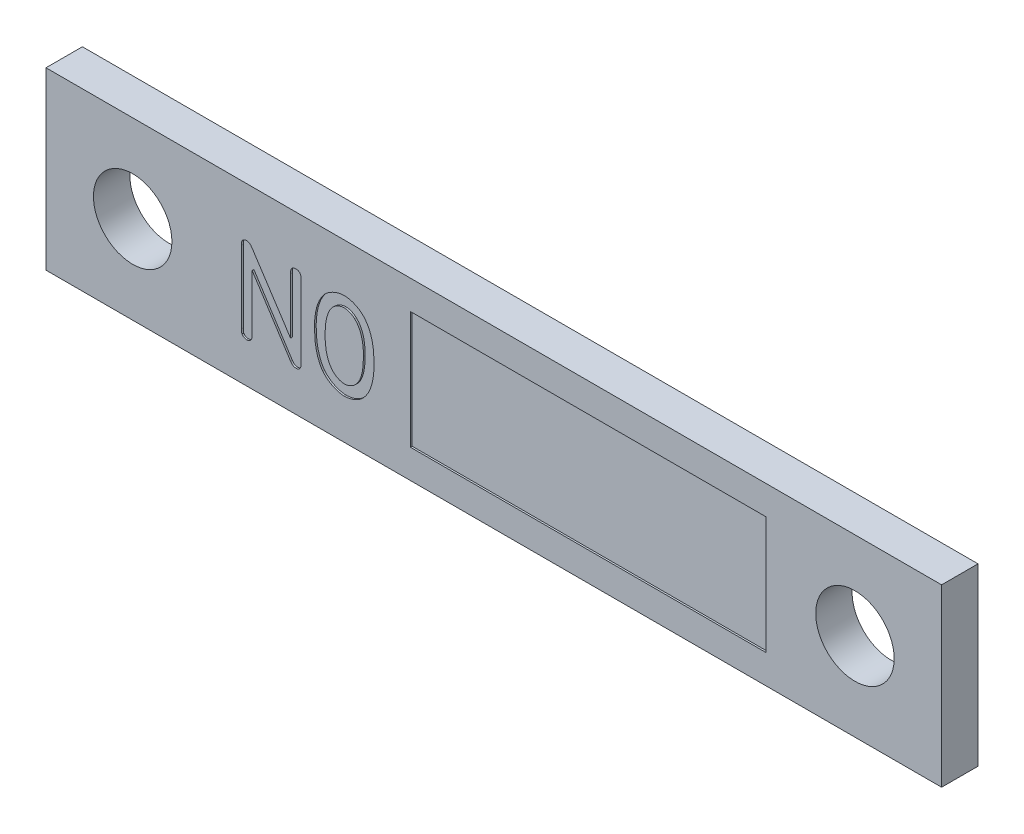
from build123d import *

# Parameters (mm, degrees)
SKETCH1_W               = 39.37
SKETCH1_H               = 7.706149234
BOSS_EXTRUDE1_DEPTH     = 1.6
CUT_EXTRUDE2_DEPTH      = 41.148992964
CUT_EXTRUDE2_DEPTH_BACK = 41.148992964
SKETCH2_R               = 1.725
WRAP1_START             = -0.0762
WRAP1_DEPTH             = 0.0762
SKETCH4_W               = 15.621930361
SKETCH4_H               = 5.167659232
CUT_EXTRUDE3_DEPTH      = 0.0762


# Read off the part's stored shape, not the designer's step: Wrap1
with BuildPart() as part:
    # Sketch1 → Boss-Extrude1 (new body)
    with BuildSketch(Plane.XY):
        with Locations((19.685, 3.853074617)):
            Rectangle(SKETCH1_W, SKETCH1_H)
    extrude(amount=BOSS_EXTRUDE1_DEPTH)

    # Sketch2 → Cut-Extrude2 (cut, two sides: drawn at the far end of the back side and taken through both)
    with BuildSketch(Plane.XY.offset(-CUT_EXTRUDE2_DEPTH_BACK)):
        with Locations((3.81, 3.853074617)):
            Circle(SKETCH2_R)
        with Locations((35.56, 3.853074617)):
            Circle(SKETCH2_R)
    extrude(amount=CUT_EXTRUDE2_DEPTH + CUT_EXTRUDE2_DEPTH_BACK, mode=Mode.SUBTRACT)

    # Wrap1 outline → Wrap1 (cut)
    # profile 1 of 2: a face of its own
    with BuildSketch(Plane.XY.offset(1.6).offset(WRAP1_START)):
        with BuildLine():
            add(Edge.make_bspline(
                [(13.114745089, 5.591356077), (13.076489227, 5.589397122), (12.999650925, 5.585462489), (12.884094832, 5.565152142), (12.768623166, 5.531800478), (12.653214187, 5.487937137), (12.542067693, 5.432545206), (12.436921753, 5.367896238), (12.338733279, 5.295413374), (12.279859734, 5.239732492), (12.250557489, 5.212019284)],
                knots=[0, 0, 0, 0, 0.118899942, 0.238814893, 0.363411662, 0.491768315, 0.621792008, 0.748493912, 0.874821655, 1, 1, 1, 1], degree=3))
            add(Edge.make_bspline(
                [(12.250557489, 5.212019284), (12.214672523, 5.169057329), (12.141638371, 5.081619877), (12.051342353, 4.932144564), (11.973476954, 4.767457905), (11.910976904, 4.586374315), (11.862253256, 4.390351187), (11.826140479, 4.180749027), (11.804813001, 3.957581581), (11.802033849, 3.804466259), (11.800607268, 3.725869831)],
                knots=[0, 0, 0, 0, 0.105704853, 0.215133666, 0.329018149, 0.449630503, 0.576639017, 0.710540967, 0.851416267, 1, 1, 1, 1], degree=3))
            add(Edge.make_bspline(
                [(11.800607268, 3.725869831), (11.801644514, 3.646192804), (11.803657438, 3.491568084), (11.821016364, 3.267294981), (11.849424873, 3.0577363), (11.889201594, 2.863083831), (11.94048741, 2.683253436), (12.004237397, 2.518833714), (12.07758583, 2.368094483), (12.138653078, 2.277954892), (12.168449785, 2.233972839)],
                knots=[0, 0, 0, 0, 0.153123595, 0.29715834, 0.432036511, 0.559346103, 0.678716767, 0.790963146, 0.898004084, 1, 1, 1, 1], degree=3))
            add(Edge.make_bspline(
                [(12.168449785, 2.233972839), (12.197481969, 2.20034568), (12.255962581, 2.132609239), (12.359424799, 2.04435806), (12.473344172, 1.964078991), (12.597649228, 1.894401209), (12.727944742, 1.837295079), (12.860759165, 1.796199072), (12.993043465, 1.768321671), (13.081902523, 1.763993136), (13.12582562, 1.761853538)],
                knots=[0, 0, 0, 0, 0.121113158, 0.243962752, 0.369981284, 0.501104923, 0.632262609, 0.757496982, 0.880130582, 1, 1, 1, 1], degree=3))
            add(Edge.make_bspline(
                [(13.12582562, 1.761853538), (13.16066766, 1.762923597), (13.231041623, 1.765084902), (13.336280248, 1.784071088), (13.442804599, 1.809323192), (13.547834205, 1.847904525), (13.650978994, 1.893495169), (13.747378401, 1.950213279), (13.839337441, 2.012004621), (13.89405399, 2.06088476), (13.921449278, 2.085357894)],
                knots=[0, 0, 0, 0, 0.118980861, 0.240317575, 0.36464631, 0.492760248, 0.622124838, 0.749523021, 0.874592076, 1, 1, 1, 1], degree=3))
            add(Edge.make_bspline(
                [(13.921449278, 2.085357894), (13.961797862, 2.128983579), (14.043692407, 2.217529576), (14.145925587, 2.371389246), (14.232621373, 2.542558615), (14.301685723, 2.732241518), (14.356969809, 2.93904029), (14.394497046, 3.164219057), (14.417828502, 3.407068515), (14.420239053, 3.575008466), (14.421485198, 3.661825822)],
                knots=[0, 0, 0, 0, 0.104917106, 0.212947712, 0.325253939, 0.443443112, 0.569142725, 0.70317811, 0.846556515, 1, 1, 1, 1], degree=3))
            add(Edge.make_bspline(
                [(14.421485198, 3.661825822), (14.42121862, 3.709999755), (14.420695864, 3.804468289), (14.415162096, 3.943349169), (14.404201638, 4.076676972), (14.389909673, 4.204681502), (14.37003367, 4.327079091), (14.346170558, 4.444031271), (14.318693671, 4.55575537), (14.285662997, 4.661709746), (14.248797167, 4.762069748), (14.207730213, 4.857095367), (14.161765845, 4.946421408), (14.111543852, 5.030780346), (14.056614795, 5.10950677), (13.997314102, 5.18270972), (13.934194919, 5.250856683), (13.887885652, 5.291235802), (13.864794961, 5.311369606)],
                knots=[0, 0, 0, 0, 0.0804244, 0.157711328, 0.231971506, 0.3037251, 0.372684803, 0.438907744, 0.502962369, 0.564674628, 0.624090994, 0.681389387, 0.737383029, 0.79168822, 0.84517995, 0.897487651, 0.948885373, 1, 1, 1, 1], degree=3))
            add(Edge.make_bspline(
                [(13.864794961, 5.311369606), (13.836926595, 5.332625567), (13.781572629, 5.37484554), (13.693058208, 5.429946975), (13.600839386, 5.477791635), (13.505222353, 5.517720766), (13.407823404, 5.549893814), (13.310010368, 5.572795207), (13.212210378, 5.587547361), (13.146951028, 5.589539842), (13.114330542, 5.590535802)],
                knots=[0, 0, 0, 0, 0.128897167, 0.256023952, 0.383031035, 0.510762582, 0.636864263, 0.759967113, 0.880017352, 1, 1, 1, 1], degree=3))
            Line((13.114330542, 5.590535802), (13.114745089, 5.591356077))
        make_face()
        with BuildLine():
            add(Edge.make_bspline(
                [(13.114745089, 5.124983513), (13.133815365, 5.124058687), (13.172911031, 5.122162714), (13.231759094, 5.110714757), (13.292507821, 5.094615493), (13.372897597, 5.06239027), (13.470255128, 5.014323779), (13.536697908, 4.959619135), (13.569207225, 4.932853088)],
                knots=[0, 0, 0, 0, 0.113760033, 0.233217626, 0.356799435, 0.48808984, 0.749531113, 1, 1, 1, 1], degree=3))
            add(Edge.make_bspline(
                [(13.569207225, 4.932853088), (13.600616446, 4.900601923), (13.664496839, 4.835009176), (13.742911766, 4.717886902), (13.809847212, 4.585769353), (13.864568958, 4.437556775), (13.905940234, 4.273143111), (13.934738151, 4.093176496), (13.953412695, 3.897322782), (13.954532218, 3.761222353), (13.955113436, 3.690563518)],
                knots=[0, 0, 0, 0, 0.100864939, 0.205140138, 0.314753714, 0.432734862, 0.558926534, 0.694652539, 0.841473711, 1, 1, 1, 1], degree=3))
            add(Edge.make_bspline(
                [(13.955113436, 3.690563518), (13.954142857, 3.621845942), (13.952276874, 3.489733379), (13.938852321, 3.299622366), (13.914467092, 3.125936925), (13.880312762, 2.96795381), (13.835852298, 2.824754701), (13.78215214, 2.694870873), (13.716809521, 2.578645164), (13.663408697, 2.51088845), (13.63735662, 2.477832722)],
                knots=[0, 0, 0, 0, 0.16117406, 0.309864224, 0.446676706, 0.572217453, 0.688558244, 0.79788685, 0.901397265, 1, 1, 1, 1], degree=3))
            add(Edge.make_bspline(
                [(13.63735662, 2.477832722), (13.619896289, 2.459964402), (13.584887718, 2.424137799), (13.525921637, 2.376369695), (13.461926839, 2.333688176), (13.393728343, 2.29709442), (13.323436467, 2.267952101), (13.253400419, 2.244984785), (13.18352688, 2.231645369), (13.137097217, 2.229350556), (13.114330542, 2.2282253)],
                knots=[0, 0, 0, 0, 0.125982952, 0.252600203, 0.382070173, 0.51368077, 0.642441633, 0.765615, 0.885069867, 1, 1, 1, 1], degree=3))
            add(Edge.make_bspline(
                [(13.114330542, 2.2282253), (13.087944412, 2.229281574), (13.034887472, 2.231405518), (12.956406659, 2.250456167), (12.877401917, 2.276122484), (12.800369836, 2.314294804), (12.726063106, 2.360412115), (12.657576688, 2.415333969), (12.594402909, 2.476713733), (12.558471819, 2.523346089), (12.540397687, 2.546803193)],
                knots=[0, 0, 0, 0, 0.116304108, 0.233863029, 0.354988023, 0.482524504, 0.612268418, 0.740398786, 0.869414858, 1, 1, 1, 1], degree=3))
            add(Edge.make_bspline(
                [(12.540397687, 2.546803193), (12.517624892, 2.58050239), (12.471107447, 2.649338935), (12.416393366, 2.765204811), (12.368206943, 2.890939881), (12.33080292, 3.029401904), (12.302432124, 3.180435838), (12.282211845, 3.345529855), (12.269952967, 3.525066539), (12.268534889, 3.649762931), (12.267800107, 3.714374752)],
                knots=[0, 0, 0, 0, 0.100043733, 0.204356952, 0.314658206, 0.431427524, 0.557025968, 0.692897545, 0.840873914, 1, 1, 1, 1], degree=3))
            add(Edge.make_bspline(
                [(12.267800107, 3.714374752), (12.268997277, 3.779541433), (12.271319741, 3.905962388), (12.286492434, 4.089294859), (12.313492146, 4.260002939), (12.351022621, 4.417600268), (12.397647767, 4.561273282), (12.455112465, 4.688654203), (12.521932369, 4.799850778), (12.5764381, 4.862378886), (12.602799542, 4.892620313)],
                knots=[0, 0, 0, 0, 0.156125124, 0.302876976, 0.440321746, 0.569779775, 0.690666127, 0.801586811, 0.904038388, 1, 1, 1, 1], degree=3))
            add(Edge.make_bspline(
                [(12.602799542, 4.892620313), (12.619744301, 4.909096818), (12.654045056, 4.9424497), (12.711607808, 4.986896925), (12.775511508, 5.025066964), (12.842702934, 5.059591298), (12.912427104, 5.08687509), (12.981237695, 5.107768137), (13.048454052, 5.120623634), (13.092658894, 5.122999339), (13.114330542, 5.12416404)],
                knots=[0, 0, 0, 0, 0.123361766, 0.249717432, 0.3786496, 0.51159882, 0.643769854, 0.769029542, 0.886765568, 1, 1, 1, 1], degree=3))
            Line((13.114330542, 5.12416404), (13.114745089, 5.124983513))
        make_face(mode=Mode.SUBTRACT)
    # profile 2 of 2: a face of its own
    with BuildSketch(Plane.XY.offset(1.6).offset(WRAP1_START)):
        with BuildLine():
            Line((10.750448123, 2.786807863), (9.056720932, 5.377366881))
            add(Edge.make_bspline(
                [(9.056720932, 5.377366881), (9.046704364, 5.391340889), (9.027744709, 5.417791302), (8.998561448, 5.453287343), (8.969588258, 5.481630475), (8.932656076, 5.510290351), (8.88116973, 5.535211294), (8.836834442, 5.537052907), (8.814350053, 5.537986871)],
                knots=[0, 0, 0, 0, 0.169217477, 0.320299826, 0.451756639, 0.567066417, 0.780440194, 1, 1, 1, 1], degree=3))
            add(Edge.make_bspline(
                [(8.814350053, 5.537986871), (8.791507372, 5.53616524), (8.745734043, 5.532514964), (8.685034279, 5.500991132), (8.632676737, 5.458970291), (8.61515441, 5.419349241), (8.606617561, 5.400045927)],
                knots=[0, 0, 0, 0, 0.25722592, 0.515442432, 0.76392431, 1, 1, 1, 1], degree=3))
            add(Edge.make_bspline(
                [(8.606617561, 5.400045927), (8.604175598, 5.391889446), (8.599119178, 5.375000325), (8.595930081, 5.344005469), (8.596078125, 5.300698242), (8.595483809, 5.266484442), (8.595122482, 5.245683443)],
                knots=[0, 0, 0, 0, 0.164010857, 0.3396071, 0.598500264, 1, 1, 1, 1], degree=3))
            Line((8.595122482, 5.245683443), (8.595942757, 2.066255023))
            add(Edge.make_bspline(
                [(8.595942757, 2.066255023), (8.596035663, 2.041972989), (8.59619257, 2.000963606), (8.598410017, 1.947621961), (8.606058085, 1.908384257), (8.614279935, 1.886845055), (8.618112639, 1.876804324)],
                knots=[0, 0, 0, 0, 0.37923184, 0.640476136, 0.832404082, 1, 1, 1, 1], degree=3))
            add(Edge.make_bspline(
                [(8.618112639, 1.876804324), (8.629849564, 1.859881284), (8.652788, 1.826807199), (8.702076905, 1.790356806), (8.760759948, 1.767363917), (8.803451595, 1.763749467), (8.825845132, 1.761853538)],
                knots=[0, 0, 0, 0, 0.24768333, 0.484067853, 0.72937223, 1, 1, 1, 1], degree=3))
            add(Edge.make_bspline(
                [(8.825845132, 1.761853538), (8.84371607, 1.762834735), (8.87779524, 1.764705838), (8.925549351, 1.7777704), (8.966274712, 1.799947498), (9.000953032, 1.829556758), (9.026418922, 1.869346152), (9.046454647, 1.915790329), (9.058339678, 1.97096258), (9.060938147, 2.0103119), (9.062315321, 2.031166809)],
                knots=[0, 0, 0, 0, 0.132129688, 0.251966061, 0.362463643, 0.472905592, 0.58518714, 0.70851143, 0.845512762, 1, 1, 1, 1], degree=3))
            Line((9.062315321, 2.031166809), (9.062315321, 4.519565882))
            Line((9.062315321, 4.519565882), (10.750448123, 1.911850843))
            add(Edge.make_bspline(
                [(10.750448123, 1.911850843), (10.767167238, 1.888237562), (10.798359968, 1.844182435), (10.858920679, 1.79590376), (10.923647591, 1.764942538), (10.969359383, 1.762872065), (10.991846378, 1.761853538)],
                knots=[0, 0, 0, 0, 0.290623159, 0.542213511, 0.774801158, 1, 1, 1, 1], degree=3))
            add(Edge.make_bspline(
                [(10.991846378, 1.761853538), (11.008907896, 1.762528945), (11.041342188, 1.763812909), (11.08692289, 1.77657156), (11.126464132, 1.796914415), (11.158646553, 1.826946961), (11.183859942, 1.865191366), (11.201299787, 1.911788775), (11.212935136, 1.966031607), (11.214937452, 2.00482514), (11.216000412, 2.025419269)],
                knots=[0, 0, 0, 0, 0.129823068, 0.246796295, 0.357906111, 0.465732929, 0.578612523, 0.704188565, 0.842964052, 1, 1, 1, 1], degree=3))
            Line((11.216000412, 2.025419269), (11.216820687, 5.257274741))
            add(Edge.make_bspline(
                [(11.216820687, 5.257274741), (11.216363001, 5.280013354), (11.215501764, 5.322800987), (11.204771278, 5.382197805), (11.188102114, 5.433114534), (11.162629745, 5.474233699), (11.128729731, 5.505489559), (11.087775645, 5.526965516), (11.039017032, 5.538791559), (11.00450106, 5.5382667), (10.986098839, 5.537986871)],
                knots=[0, 0, 0, 0, 0.162079845, 0.3049884, 0.429154783, 0.542410064, 0.646080047, 0.75442866, 0.869073422, 1, 1, 1, 1], degree=3))
            add(Edge.make_bspline(
                [(10.986098839, 5.537986871), (10.966594793, 5.537636005), (10.929861877, 5.536975201), (10.878759071, 5.52478956), (10.835935097, 5.503325222), (10.802403762, 5.471113573), (10.776961756, 5.428778672), (10.760456259, 5.37482148), (10.751164508, 5.309234366), (10.75016768, 5.261592606), (10.74962865, 5.235830518)],
                knots=[0, 0, 0, 0, 0.130999231, 0.246717201, 0.350532776, 0.449563782, 0.555402612, 0.679484004, 0.826682279, 1, 1, 1, 1], degree=3))
            Line((10.74962865, 5.235830518), (10.750448123, 2.786807863))
        make_face()
    extrude(amount=WRAP1_DEPTH, mode=Mode.SUBTRACT)

    # Sketch4 → Cut-Extrude3 (cut)
    with BuildSketch(Plane.XY.offset(1.6)):
        with Locations((23.834741843, 3.853074617)):
            Rectangle(SKETCH4_W, SKETCH4_H)
    extrude(amount=-CUT_EXTRUDE3_DEPTH, mode=Mode.SUBTRACT)


solid = part.part
